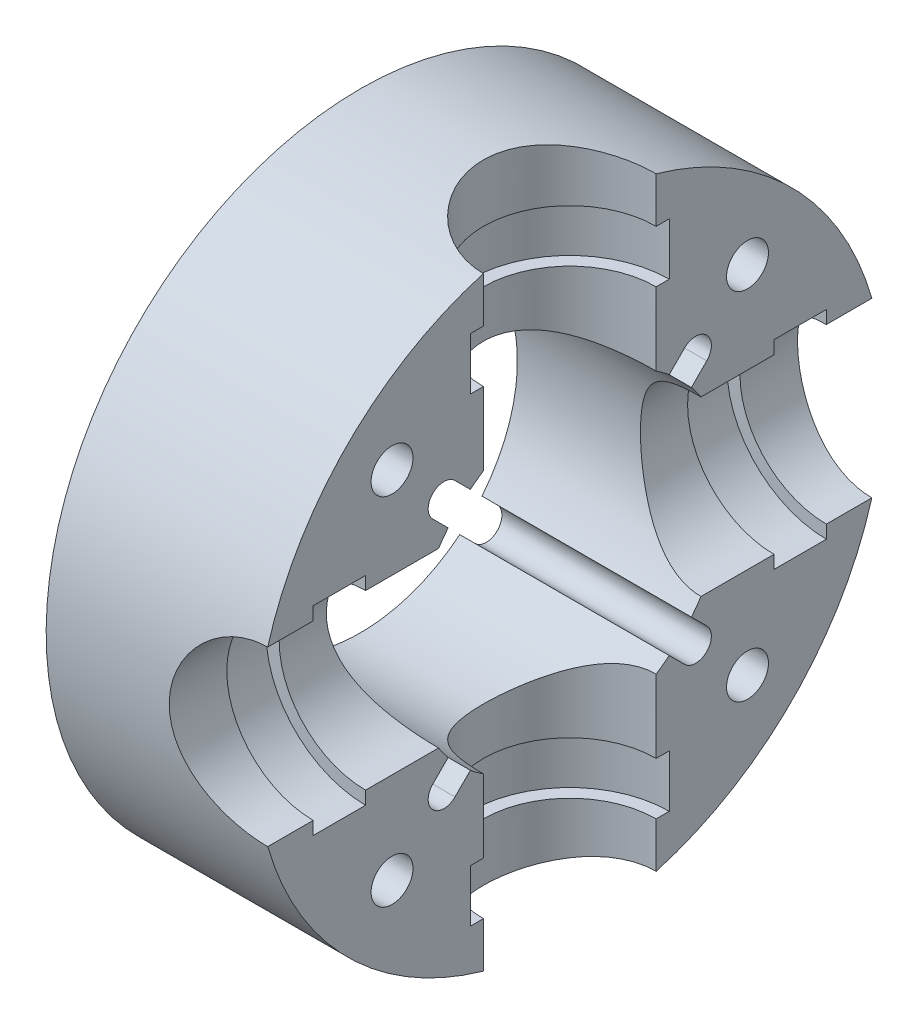
from build123d import *

# Parameters (mm, degrees)
SKETCH1_R           = 30
SKETCH1_R_2         = 15
BOSS_EXTRUDE1_DEPTH = 40
SKETCH3_R           = 9.5
CUT_EXTRUDE1_DEPTH  = 2.5
SKETCH4_R           = 8.25
CUT_EXTRUDE2_DEPTH  = 15
CIRPATTERN1_COUNT   = 4
SKETCH5_R           = 2
CUT_EXTRUDE3_DEPTH  = 47.904157769
CUT_EXTRUDE4_DEPTH  = 47.904157769


# Read off the part's stored shape, not the designer's step: Body-Delete/Keep 1
with BuildPart() as part:
    # Sketch1 → Boss-Extrude1 (new body)
    with BuildSketch(Plane(origin=(0, 0, 0), x_dir=(0, 0, -1), z_dir=(1, 0, 0))):
        Circle(SKETCH1_R)
        Circle(SKETCH1_R_2, mode=Mode.SUBTRACT)
    extrude(amount=BOSS_EXTRUDE1_DEPTH)

    # Sketch3 → Cut-Extrude1 (cut, symmetric)
    with BuildSketch(Plane.XY.offset(22)):
        with Locations((20, 0)):
            Circle(SKETCH3_R)
    cut_extrude1 = extrude(amount=CUT_EXTRUDE1_DEPTH, both=True, mode=Mode.SUBTRACT)

    # Sketch4 → Cut-Extrude2 (cut, symmetric)
    with BuildSketch(Plane.XY.offset(22)):
        with Locations((20, 0)):
            Circle(SKETCH4_R)
    cut_extrude2 = extrude(amount=CUT_EXTRUDE2_DEPTH, both=True, mode=Mode.SUBTRACT)

    # CirPattern1: Cut-Extrude1, Cut-Extrude2 ×4 about axis
    cirpattern1_axis = Axis((0, 0, 0), (1, 0, 0))
    add([cut_extrude1.rotate(cirpattern1_axis, i * 360 / CIRPATTERN1_COUNT) for i in range(1, CIRPATTERN1_COUNT)], mode=Mode.SUBTRACT)
    add([cut_extrude2.rotate(cirpattern1_axis, i * 360 / CIRPATTERN1_COUNT) for i in range(1, CIRPATTERN1_COUNT)], mode=Mode.SUBTRACT)


with BuildPart() as body_2:
    # Split1: the piece on the far side of the plane
    add(part.part)
    split(bisect_by=Plane(origin=(20, 0, 0), x_dir=(0, 0, 1), z_dir=(1, 0, 0)), keep=Keep.BOTTOM)

    # Sketch5 → Cut-Extrude3 (cut, through all)
    with BuildSketch(Plane.ZY):
        with Locations((-16.970562748, 16.970562748)):
            Circle(SKETCH5_R)
        with Locations((16.970562748, 16.970562748)):
            Circle(SKETCH5_R)
        with Locations((16.970562748, -16.970562748)):
            Circle(SKETCH5_R)
        with Locations((-16.970562748, -16.970562748)):
            Circle(SKETCH5_R)
    extrude(amount=-CUT_EXTRUDE3_DEPTH, mode=Mode.SUBTRACT)

    # Sketch6 → Cut-Extrude4 (cut, through all)
    with BuildSketch(Plane(origin=(20, 0, 0), x_dir=(0, 0, -1), z_dir=(1, 0, 0))):
        with BuildLine():
            ThreePointArc((-11.614095631, 9.492775288), (-11.124297731, 10.062305899), (-10.606601718, 10.606601718))
            ThreePointArc((-10.606601718, 10.606601718), (-10.062305899, 11.124297731), (-9.492775288, 11.614095631))
            Line((-9.492775288, 11.614095631), (-10.960155108, 13.081475452))
            ThreePointArc((-10.960155108, 13.081475452), (-13.081475452, 13.081475452), (-13.081475452, 10.960155108))
            Line((-13.081475452, 10.960155108), (-11.614095631, 9.492775288))
        make_face()
        with BuildLine():
            ThreePointArc((13.081475452, 10.960155108), (13.081475452, 13.081475452), (10.960155108, 13.081475452))
            Line((10.960155108, 13.081475452), (9.492775288, 11.614095631))
            ThreePointArc((9.492775288, 11.614095631), (10.606601718, 10.606601718), (11.614095631, 9.492775288))
            Line((11.614095631, 9.492775288), (13.081475452, 10.960155108))
        make_face()
        with BuildLine():
            ThreePointArc((10.960155108, -13.081475452), (13.081475452, -13.081475452), (13.081475452, -10.960155108))
            Line((13.081475452, -10.960155108), (11.614095631, -9.492775288))
            ThreePointArc((11.614095631, -9.492775288), (10.606601718, -10.606601718), (9.492775288, -11.614095631))
            Line((9.492775288, -11.614095631), (10.960155108, -13.081475452))
        make_face()
        with BuildLine():
            ThreePointArc((-13.081475452, -10.960155108), (-13.081475452, -13.081475452), (-10.960155108, -13.081475452))
            Line((-10.960155108, -13.081475452), (-9.492775288, -11.614095631))
            ThreePointArc((-9.492775288, -11.614095631), (-10.606601718, -10.606601718), (-11.614095631, -9.492775288))
            Line((-11.614095631, -9.492775288), (-13.081475452, -10.960155108))
        make_face()
    extrude(amount=-CUT_EXTRUDE4_DEPTH, mode=Mode.SUBTRACT)


with BuildPart() as part_1:
    add(part.part)

    # Split1
    split(bisect_by=Plane(origin=(20, 0, 0), x_dir=(0, 0, 1), z_dir=(1, 0, 0)), keep=Keep.TOP)


solid = body_2.part
